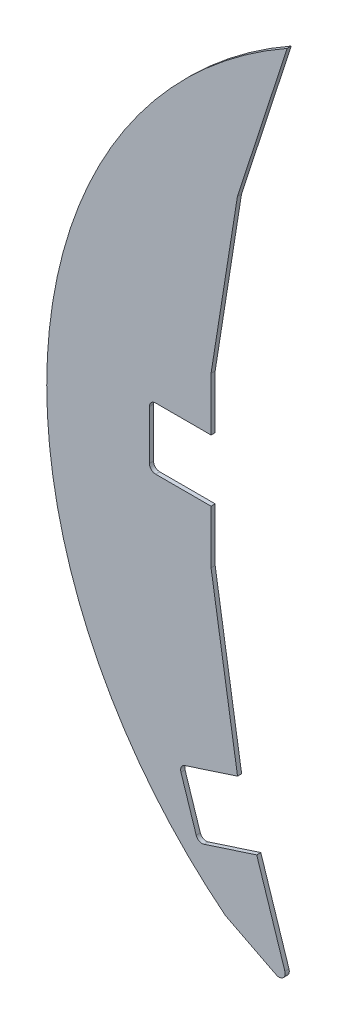
from build123d import *

# Parameters (mm, degrees)
SM_BASE_FLANGE_1_DEPTH = 2


# Sheet-metal steps are written as plain solids
with BuildPart() as part:
    # Sketch 1 → Базовая кромка1 (new body)
    with BuildSketch(Plane.XY):
        with BuildLine():
            Line((-28.388920969, 12), (-28.388920969, -12))
            ThreePointArc((-28.388920969, -12), (-27.510241313, -14.121320344), (-25.388920969, -15))
            Line((-25.388920969, -15), (1.611079031, -15))
            Line((1.611079031, -15), (1.611079031, -41.004699494))
            Line((1.611079031, -41.004699494), (14.502501119, -122.397935229))
            Line((14.502501119, -122.397935229), (-11.116749626, -130.722134398))
            ThreePointArc((-11.116749626, -130.722134398), (-12.862718215, -132.213332448), (-13.042868191, -134.50235493))
            Line((-13.042868191, -134.50235493), (-5.626460326, -157.327711321))
            ThreePointArc((-5.626460326, -157.327711321), (-4.135262277, -159.073679911), (-1.846239794, -159.253829887))
            Line((-1.846239794, -159.253829887), (23.832286146, -150.910371039))
            Line((23.832286146, -150.910371039), (37.544374419, -193.111839379))
            ThreePointArc((37.544374419, -193.111839379), (36.639549016, -196.320108259), (33.329233371, -196.711909935))
            Line((33.329233371, -196.711909935), (8.597245129, -184.110332509))
            ThreePointArc((8.597245129, -184.110332509), (-77.67448455, 14.217890909), (38.659903534, 196.545084972))
            Line((38.659903534, 196.545084972), (14.44017549, 122.004426694))
            Line((14.44017549, 122.004426694), (1.611079031, 41.004699494))
            Line((1.611079031, 41.004699494), (1.611079031, 15))
            Line((1.611079031, 15), (-25.388920969, 15))
            ThreePointArc((-25.388920969, 15), (-27.510241313, 14.121320344), (-28.388920969, 12))
        make_face()
    extrude(amount=-SM_BASE_FLANGE_1_DEPTH)


solid = part.part
